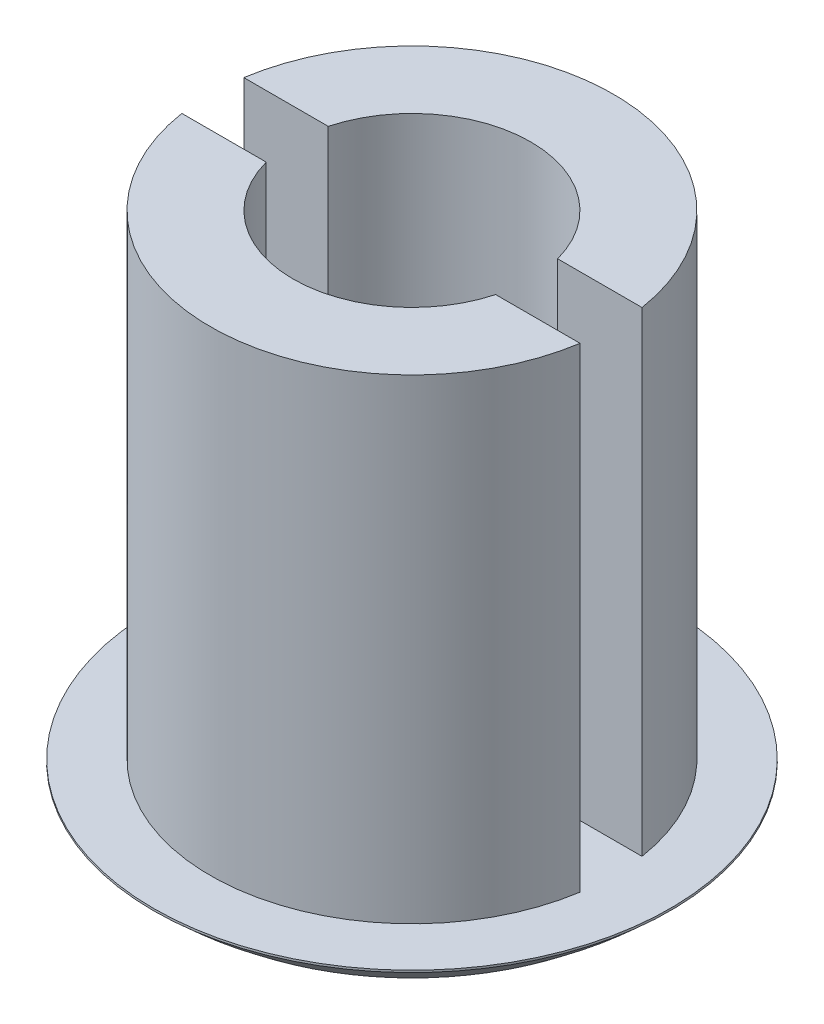
from build123d import *

# Parameters (mm, degrees)
SKETCH1_R           = 12.5
BOSS_EXTRUDE1_DEPTH = 0.1
DOME1_FACE_RADIUS   = 12.5
DOME1_HEIGHT        = 5
SKETCH2_R           = 9.75
BOSS_EXTRUDE2_DEPTH = 23
CUT_EXTRUDE1_REACH  = 35.198
SKETCH3_W           = 22.394577403
SKETCH3_H           = 3


# Read off the part's stored shape, not the designer's step: Shell3
with BuildPart() as part:
    # Sketch1 → Boss-Extrude1 (new body)
    with BuildSketch(Plane(origin=(0, 0, 0), x_dir=(1, 0, 0), z_dir=(0, 1, 0))):
        with Locations(Location((0, 0, 0), (0, 0, 270))):
            Circle(SKETCH1_R)
    extrude(amount=BOSS_EXTRUDE1_DEPTH)

    # Dome1: a dome of height H over a round flat face of radius A is a cap of a sphere of radius (A * A + H * H) / (2 * H)
    dome1_r = (DOME1_FACE_RADIUS * DOME1_FACE_RADIUS + DOME1_HEIGHT * DOME1_HEIGHT) / (2 * DOME1_HEIGHT)
    dome1_base = Plane((0, 0, 0), z_dir=(0, -1, 0))
    with Locations(dome1_base.offset(DOME1_HEIGHT - dome1_r)):
        dome1_ball = Sphere(dome1_r, mode=Mode.PRIVATE)
    add(split(dome1_ball, bisect_by=dome1_base, keep=Keep.TOP, mode=Mode.PRIVATE))

    # Sketch2 → Boss-Extrude2 (add)
    with BuildSketch(Plane(origin=(0, 0.1, 0), x_dir=(1, 0, 0), z_dir=(0, 1, 0))):
        with Locations(Location((0, 0, 0), (0, 0, 270))):
            Circle(SKETCH2_R)
    extrude(amount=BOSS_EXTRUDE2_DEPTH)

    # Shell3 outline → Shell3 (revolve, cut)
    with BuildSketch(Plane.XY):
        with BuildLine():
            Line((0, 23.1), (0, -1))
            ThreePointArc((0, -1), (2.939346569, -0.690783248), (5.750000013, 0.223328602))
            Line((5.750000013, 0.223328602), (5.75, 23.1))
            Line((5.75, 23.1), (0, 23.1))
        make_face()
    revolve(axis=Axis((0, 0, 0), (0, 1, 0)), mode=Mode.SUBTRACT)

    # Cut-Extrude1: up to this face of the body (flat: up to its plane)
    cut_extrude1_end = Plane(part.part.faces().sort_by_distance((0, 0.1, -12.146446609))[0])
    # Sketch3 → Cut-Extrude1 (cut, up to the picked face)
    with BuildSketch(Plane(origin=(0, 23.1, 0), x_dir=(1, 0, 0), z_dir=(0, 1, 0)), mode=Mode.PRIVATE) as cut_extrude1_sk1:
        with Locations((0.557168459, 0)):
            Rectangle(SKETCH3_W, SKETCH3_H)
    cut_extrude1_tool1 = split(extrude(cut_extrude1_sk1.sketch, amount=-CUT_EXTRUDE1_REACH, mode=Mode.PRIVATE), bisect_by=cut_extrude1_end, keep=Keep.BOTH, mode=Mode.PRIVATE)
    add(cut_extrude1_tool1.solids().sort_by(Axis((0.557168, 23.1, 0), (0, -1, 0)))[0], mode=Mode.SUBTRACT)


solid = part.part
